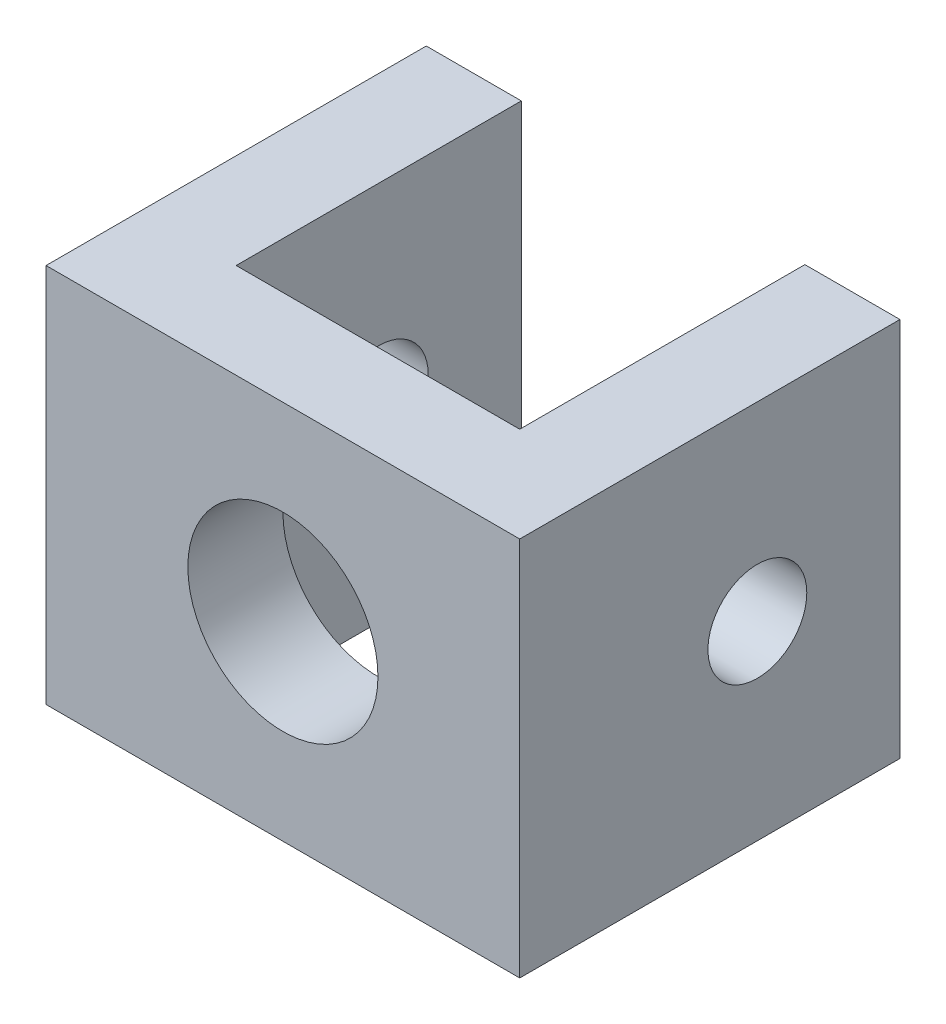
from build123d import *

# Parameters (mm, degrees)
BOSS_EXTRUDE1_DEPTH     = 25.4
SKETCH2_R               = 6.35
CUT_EXTRUDE1_DEPTH      = 48.871592404
CUT_EXTRUDE2_DEPTH      = 44.933218831
CUT_EXTRUDE2_DEPTH_BACK = 44.933218831
SKETCH5_R               = 3.302


with BuildPart() as part:
    # Sketch1 → Boss-Extrude1 (new body)
    with BuildSketch(Plane(origin=(0, 0, 0), x_dir=(1, 0, 0), z_dir=(0, 1, 0))):
        Polygon((0, 0), (0, 25.4), (6.35, 25.4), (6.35, 6.35), (25.294420667, 6.35), (25.294420667, 25.4), (31.644420667, 25.4), (31.644420667, 0), align=None)
    extrude(amount=BOSS_EXTRUDE1_DEPTH)

    # Sketch2 → Cut-Extrude1 (cut, through all)
    with BuildSketch(Plane.XY):
        with Locations((15.822210333, 12.7)):
            Circle(SKETCH2_R)
    extrude(amount=-CUT_EXTRUDE1_DEPTH, mode=Mode.SUBTRACT)

    # Sketch5 → Cut-Extrude2 (cut, two sides: drawn at the far end of the back side and taken through both)
    with BuildSketch(Plane(origin=(6.35, 0, 0), x_dir=(0, 0, -1), z_dir=(1, 0, 0)).offset(-CUT_EXTRUDE2_DEPTH_BACK)):
        with Locations((15.875, 12.7)):
            Circle(SKETCH5_R)
    extrude(amount=CUT_EXTRUDE2_DEPTH + CUT_EXTRUDE2_DEPTH_BACK, mode=Mode.SUBTRACT)


solid = part.part
